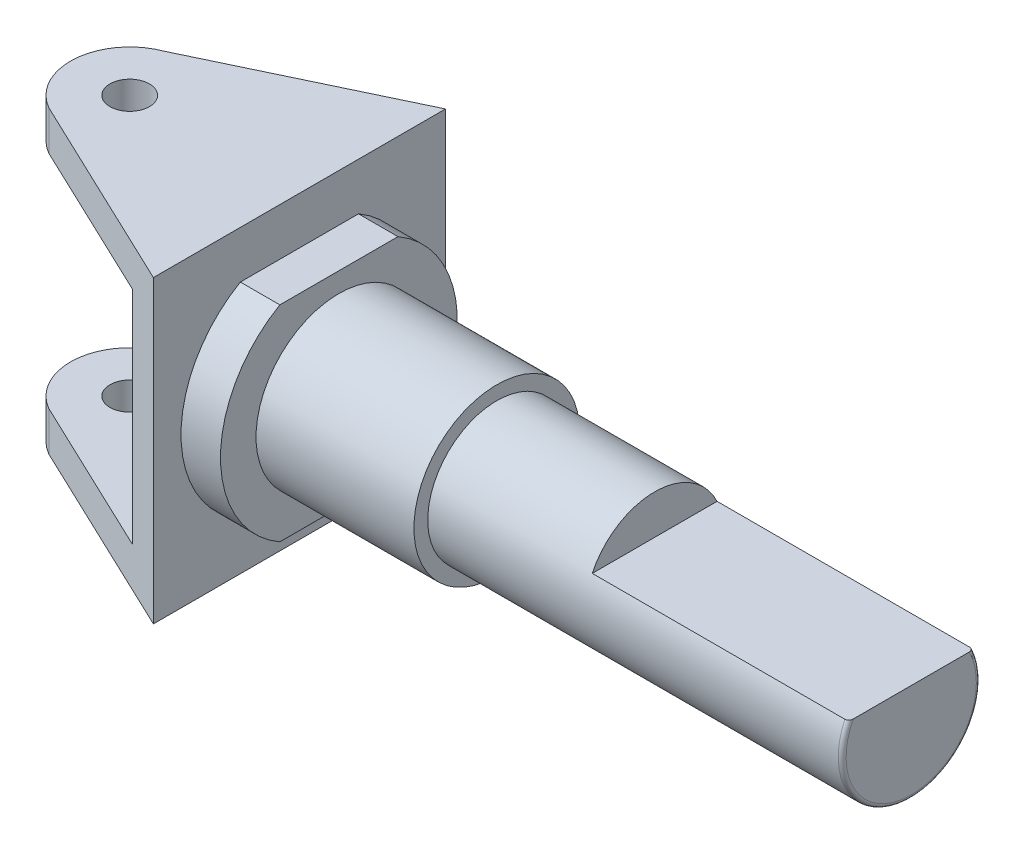
from build123d import *

# Parameters (mm, degrees)
BOSS_EXTRUDE1_DEPTH = 74
CUT_EXTRUDE1_DEPTH  = 100
SKETCH3_R           = 5
CUT_EXTRUDE2_DEPTH  = 100
F_3DSKETCH4_R       = 30
BOSS_EXTRUDE2_DEPTH = 15
F_3DSKETCH5_R       = 21
BOSS_EXTRUDE3_DEPTH = 45
F_3DSKETCH6_R       = 17.5
BOSS_EXTRUDE4_DEPTH = 110
FILLET1_R           = 1
CUT_EXTRUDE3_START  = -65
CUT_EXTRUDE3_DEPTH  = 65
CUT_EXTRUDE4_START  = -10
CUT_EXTRUDE4_DEPTH  = 10


with BuildPart() as part:
    # Sketch1 → Boss-Extrude1 (new body)
    with BuildSketch(Plane.XY):
        Polygon((-61.949924481, 30.103941839), (-61.949924481, 20.103941839), (-13.949924481, 20.103941839), (-13.949924481, -35.896058161), (-61.949924481, -35.896058161), (-61.949924481, -45.896058161), (-3.949924481, -45.896058161), (-3.949924481, 30.103941839), align=None)
    extrude(amount=BOSS_EXTRUDE1_DEPTH)

    # Sketch2 → Cut-Extrude1 (cut)
    with BuildSketch(Plane(origin=(0, 30.103941839, 0), x_dir=(1, 0, 0), z_dir=(0, 1, 0))):
        with BuildLine():
            Line((-61.949924481, -74), (-3.949924481, -74))
            Line((-3.949924481, -74), (-54.47214826, -49.97752478))
            ThreePointArc((-54.47214826, -49.97752478), (-59.946719407, -44.488879866), (-61.949924481, -37))
            Line((-61.949924481, -37), (-61.949924481, -74))
        make_face()
        with BuildLine():
            Line((-61.949924481, 0), (-61.949924481, -37))
            ThreePointArc((-61.949924481, -37), (-59.294185522, -28.478308892), (-52.267361901, -22.974136059))
            Line((-52.267361901, -22.974136059), (-3.949924481, 0))
            Line((-3.949924481, 0), (-61.949924481, 0))
        make_face()
    extrude(amount=-CUT_EXTRUDE1_DEPTH, mode=Mode.SUBTRACT)

    # Sketch3 → Cut-Extrude2 (cut)
    with BuildSketch(Plane(origin=(0, 30.103941839, 0), x_dir=(1, 0, 0), z_dir=(0, 1, 0))):
        with Locations((-46.949924481, -37)):
            Circle(SKETCH3_R)
    extrude(amount=-CUT_EXTRUDE2_DEPTH, mode=Mode.SUBTRACT)

    # 3DSketch4 → Boss-Extrude2 (add)
    with BuildSketch(Plane(origin=(-8.949924481, -7.896058161, 37), x_dir=(0, 0, 1), z_dir=(1, 0, 0))):
        Circle(F_3DSKETCH4_R)
    extrude(amount=BOSS_EXTRUDE2_DEPTH)

    # 3DSketch5 → Boss-Extrude3 (add)
    with BuildSketch(Plane(origin=(1.050075519, -7.896058161, 37), x_dir=(0, 0, 1), z_dir=(1, 0, 0))):
        Circle(F_3DSKETCH5_R)
    extrude(amount=BOSS_EXTRUDE3_DEPTH)

    # 3DSketch6 → Boss-Extrude4 (add)
    with BuildSketch(Plane(origin=(41.050075519, -7.896058161, 37), x_dir=(0, 0, 1), z_dir=(1, 0, 0))):
        Circle(F_3DSKETCH6_R)
    extrude(amount=BOSS_EXTRUDE4_DEPTH)

    # Fillet1
    fillet1_edges = [part.edges().sort_by_distance(p)[0] for p in [
        (151.050075519, -7.896058161, 19.5),
    ]]
    fillet(fillet1_edges, radius=FILLET1_R)

    # Sketch4 → Cut-Extrude3 (cut)
    with BuildSketch(Plane(origin=(151.050075519, 0, 0), x_dir=(0, 0, -1), z_dir=(1, 0, 0)).offset(CUT_EXTRUDE3_START)):
        with BuildLine():
            Line((-52.811388301, -0.396058161), (-21.188611699, -0.396058161))
            ThreePointArc((-21.188611699, -0.396058161), (-37, 9.603941839), (-52.811388301, -0.396058161))
        make_face()
    extrude(amount=CUT_EXTRUDE3_DEPTH, mode=Mode.SUBTRACT)

    # Sketch5 → Cut-Extrude4 (cut)
    with BuildSketch(Plane(origin=(6.050075519, 0, 0), x_dir=(0, 0, -1), z_dir=(1, 0, 0)).offset(CUT_EXTRUDE4_START)):
        with BuildLine():
            Line((-22.033370453, 18.103941839), (-51.966629547, 18.103941839))
            ThreePointArc((-51.966629547, 18.103941839), (-37, 22.103941839), (-22.033370453, 18.103941839))
        make_face()
        with BuildLine():
            Line((-51.966629547, -33.896058161), (-22.033370453, -33.896058161))
            ThreePointArc((-22.033370453, -33.896058161), (-37, -37.896058161), (-51.966629547, -33.896058161))
        make_face()
    extrude(amount=CUT_EXTRUDE4_DEPTH, mode=Mode.SUBTRACT)


solid = part.part
